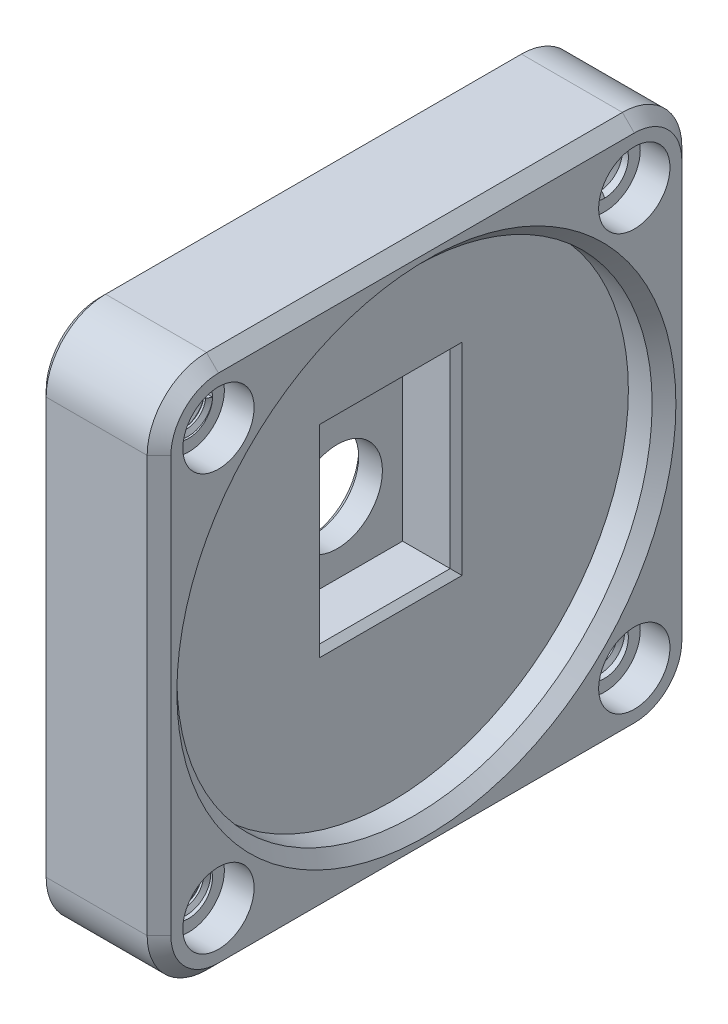
from build123d import *

# Parameters (mm, degrees)
SKETCH1_W           = 45
SKETCH1_H           = 45
SKETCH1_R           = 20
BOSS_EXTRUDE1_DEPTH = 10
SKETCH1_7_W         = 11
SKETCH1_7_H         = 16
SKETCH1_7_R         = 3.8
BOSS_EXTRUDE2_DEPTH = 2.5
SKETCH1_8_R         = 20
SKETCH1_8_W         = 11
SKETCH1_8_H         = 16
BOSS_EXTRUDE3_DEPTH = 7
FILLET1_R           = 5
CHAMFER1_SIZE       = 1
CHAMFER2_SIZE       = 0.5
CHAMFER3_SIZE       = 0.5
THREAD1_PITCH       = 0.7
CIRPATTERN4_COUNT   = 4


with BuildPart() as part:
    # Sketch1 → Boss-Extrude1 (new body)
    with BuildSketch(Plane(origin=(0, 0, 0), x_dir=(0, 0, -1), z_dir=(1, 0, 0))):
        with Locations((22.5, 22.5)):
            Rectangle(SKETCH1_W, SKETCH1_H)
        with Locations((22.5, 22.5)):
            Circle(SKETCH1_R, mode=Mode.SUBTRACT)
    extrude(amount=BOSS_EXTRUDE1_DEPTH)



with BuildPart() as body_2:
    # Sketch1<7> → Boss-Extrude2 (new body)
    with BuildSketch(Plane(origin=(0, 0, 0), x_dir=(0, 0, -1), z_dir=(1, 0, 0))):
        with Locations((22.5, 24.5)):
            Rectangle(SKETCH1_7_W, SKETCH1_7_H)
        with Locations((22.5, 22.5)):
            Circle(SKETCH1_7_R, mode=Mode.SUBTRACT)
    extrude(amount=BOSS_EXTRUDE2_DEPTH)


with BuildPart() as part_1:
    add(part.part)

    add(body_2.part)  # Boss-Extrude3 merges body 2
    # Sketch1<8> → Boss-Extrude3 (add)
    with BuildSketch(Plane(origin=(0, 0, 0), x_dir=(0, 0, -1), z_dir=(1, 0, 0))):
        with Locations((22.5, 22.5)):
            Circle(SKETCH1_8_R)
        with Locations((22.5, 24.5)):
            Rectangle(SKETCH1_8_W, SKETCH1_8_H, mode=Mode.SUBTRACT)
    extrude(amount=BOSS_EXTRUDE3_DEPTH)

    # Fillet1
    fillet1_edges = [part_1.edges().sort_by_distance(p)[0] for p in [
        (5, 0, 0),
        (5, 45, 0),
        (5, 45, -45),
        (5, 0, -45),
    ]]
    fillet(fillet1_edges, radius=FILLET1_R)

    # Chamfer1
    chamfer1_edges = [part_1.edges().sort_by_distance(p)[0] for p in [
        (10, 45, -22.5),
        (10, 22.5, -45),
        (10, 0, -22.5),
        (10, 22.5, 0),
        (10, 43.535533906, -1.464466094),
        (10, 1.464466094, -1.464466094),
        (10, 1.464466094, -43.535533906),
        (10, 43.535533906, -43.535533906),
        (10, 22.5, -2.5),
    ]]
    chamfer(chamfer1_edges, length=CHAMFER1_SIZE)

    # Chamfer2
    chamfer2_edges = [part_1.edges().sort_by_distance(p)[0] for p in [
        (7, 16.5, -22.5),
        (7, 24.5, -17),
        (7, 32.5, -22.5),
        (7, 24.5, -28),
    ]]
    chamfer(chamfer2_edges, length=CHAMFER2_SIZE)

    # Chamfer3
    chamfer3_edges = [part_1.edges().sort_by_distance(p)[0] for p in [
        (0, 22.5, -18.7),
        (0, 45, -22.5),
        (0, 0, -22.5),
        (0, 22.5, 0),
        (0, 22.5, -45),
        (0, 43.535533906, -1.464466094),
        (0, 1.464466094, -1.464466094),
        (0, 1.464466094, -43.535533906),
        (0, 43.535533906, -43.535533906),
    ]]
    chamfer(chamfer3_edges, length=CHAMFER3_SIZE)

    # Sketch8 → CBORE for M4 Pan Head Screw1 (revolve, cut)
    with BuildSketch(Plane(origin=(10, 40, -5), x_dir=(0, 0, -1), z_dir=(0, 1, 0))):
        Polygon((0, 0), (0, 9.201721238), (2, 8), (2, 2.5), (3, 2.5), (3, 0), align=None)
    cbore_for_m4_pan_head_screw1 = revolve(axis=Axis((16.35, 40, -5), (-1, 0, 0)), mode=Mode.SUBTRACT)

    # Thread1: the profile of Thread Profile1 profile screwed along a right-hand helix of 7 turns, 6 arcs to a turn; built about Z, then put on its axis
    thread1_z = Axis((0, 0, 0), (0, 0, 1))
    thread1_corners = [(2.0003, 0, -0.000173205), (2.0003, 0, 0.612673203), (1.621113887, 0, 0.393749999), (1.621113887, 0, 0.218749999)]
    with BuildLine(mode=Mode.PRIVATE) as thread1_profile:
        Line(thread1_corners[0], thread1_corners[1])
        Line(thread1_corners[1], thread1_corners[2])
        Line(thread1_corners[2], thread1_corners[3])
        Line(thread1_corners[3], thread1_corners[0])
    thread1_cap = Face(thread1_profile.wire())
    thread1_turn_angles = [0, 30, 60, 90, 120, 150, 180, 210, 240, 270, 300, 330, 360]
    thread1_turn_weights = [1, 0.8660254037844387, 1, 0.8660254037844387, 1, 0.8660254037844387, 1, 0.8660254037844387, 1, 0.8660254037844387, 1, 0.8660254037844387, 1]
    thread1_turn_rails = [Edge.make_bspline([Vector(p[0], p[1], 0).rotate(thread1_z, thread1_turn_angles[k]) / thread1_turn_weights[k] + Vector(0, 0, p[2] + THREAD1_PITCH * thread1_turn_angles[k] / 360) for k in range(13)], [0, 0, 0, 1, 1, 2, 2, 3, 3, 4, 4, 5, 5, 6, 6, 6], 2, thread1_turn_weights) for p in thread1_corners]
    thread1_turn_sides = [Face.make_surface_from_curves(thread1_turn_rails[p[0]], thread1_turn_rails[p[1]]) for p in [(0, 1), (1, 2), (2, 3), (3, 0)]]
    thread1 = Plane(origin=(2, 40, -5), x_dir=(0, 0, -1), z_dir=(1, 0, 0)) * Solid(Shell([*[p.moved(Location((0, 0, THREAD1_PITCH * i))) for i in range(7) for p in thread1_turn_sides], thread1_cap, thread1_cap.rotate(thread1_z, 2520).moved(Location((0, 0, THREAD1_PITCH * 2520 / 360)))]))
    add(thread1)

    # CirPattern4: CBORE for M4 Pan Head Screw1, Thread1 ×4 about axis
    cirpattern4_axis = Axis((10, 22.5, -22.5), (1, 0, 0))
    add([cbore_for_m4_pan_head_screw1.rotate(cirpattern4_axis, i * 360 / CIRPATTERN4_COUNT) for i in range(1, CIRPATTERN4_COUNT)], mode=Mode.SUBTRACT)
    add([thread1.rotate(cirpattern4_axis, i * 360 / CIRPATTERN4_COUNT) for i in range(1, CIRPATTERN4_COUNT)])


solid = part_1.part
